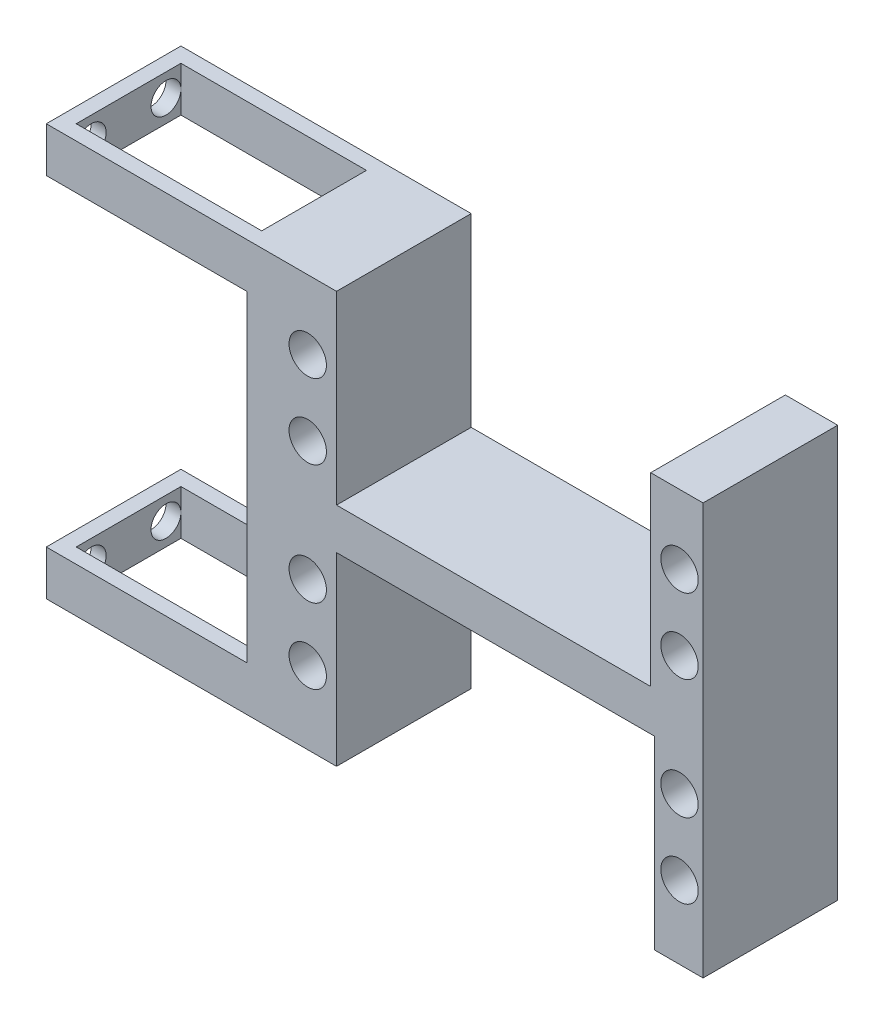
from build123d import *

# Parameters (mm, degrees)
SKETCH2_W           = 61
SKETCH2_H           = 55
SKETCH2_W_2         = 42
SKETCH2_H_2         = 20.5
SKETCH2_W_3         = 42.5
BOSS_EXTRUDE1_DEPTH = 18
SKETCH3_R           = 2.5
CUT_EXTRUDE1_DEPTH  = 10
SKETCH5_W           = 2
SKETCH5_H           = 6
BOSS_EXTRUDE2_DEPTH = 26.8
BOSS_EXTRUDE3_REACH = 85.678
SKETCH6_W           = 2
SKETCH6_H           = 6
SKETCH7_R           = 2
CUT_EXTRUDE2_DEPTH  = 10
CUT_EXTRUDE3_REACH  = 86.083
SKETCH8_W           = 42
SKETCH8_H           = 4.25
SKETCH8_W_2         = 42.5


with BuildPart() as part:
    # Sketch2 → Boss-Extrude1 (new body)
    with BuildSketch(Plane.XY):
        with Locations((30.5, 27.5)):
            Rectangle(SKETCH2_W, SKETCH2_H)
        with Locations((33, 40.5)):
            Rectangle(SKETCH2_W_2, SKETCH2_H_2, mode=Mode.SUBTRACT)
        with Locations((33.25, 14.5)):
            Rectangle(SKETCH2_W_3, SKETCH2_H_2, mode=Mode.SUBTRACT)
    extrude(amount=BOSS_EXTRUDE1_DEPTH)

    # Sketch3 → Cut-Extrude1 (cut)
    with BuildSketch(Plane.XY.offset(18)):
        with Locations((8.15, 45.75)):
            Circle(SKETCH3_R)
        with Locations((8.15, 35.75)):
            Circle(SKETCH3_R)
        with Locations((57.85, 35.75)):
            Circle(SKETCH3_R)
        with Locations((57.85, 45.75)):
            Circle(SKETCH3_R)
        with Locations((8.15, 19.75)):
            Circle(SKETCH3_R)
        with Locations((8.15, 9.75)):
            Circle(SKETCH3_R)
        with Locations((57.85, 9.75)):
            Circle(SKETCH3_R)
        with Locations((57.85, 19.75)):
            Circle(SKETCH3_R)
    extrude(amount=-CUT_EXTRUDE1_DEPTH, mode=Mode.SUBTRACT)

    # Sketch5 → Boss-Extrude2 (add)
    with BuildSketch(Plane.ZY):
        with Locations((1, 52)):
            Rectangle(SKETCH5_W, SKETCH5_H)
        with Locations((17, 52)):
            Rectangle(SKETCH5_W, SKETCH5_H)
        with Locations((1, 3)):
            Rectangle(SKETCH5_W, SKETCH5_H)
        with Locations((17, 3)):
            Rectangle(SKETCH5_W, SKETCH5_H)
    extrude(amount=BOSS_EXTRUDE2_DEPTH)

    # Sketch6 → Boss-Extrude3 (add, up to next)
    with BuildSketch(Plane.XY.offset(2), mode=Mode.PRIVATE) as boss_extrude3_sk1:
        with Locations((-25.8, 52)):
            Rectangle(SKETCH6_W, SKETCH6_H)
    boss_extrude3_tool1 = extrude(boss_extrude3_sk1.sketch, amount=BOSS_EXTRUDE3_REACH, mode=Mode.PRIVATE) - part.part
    # Sketch6 → Boss-Extrude3 (add, up to next)
    with BuildSketch(Plane.XY.offset(2), mode=Mode.PRIVATE) as boss_extrude3_sk2:
        with Locations((-25.8, 3)):
            Rectangle(SKETCH6_W, SKETCH6_H)
    boss_extrude3_tool2 = extrude(boss_extrude3_sk2.sketch, amount=BOSS_EXTRUDE3_REACH, mode=Mode.PRIVATE) - part.part
    add(boss_extrude3_tool1.solids().sort_by_distance((-25.8, 52, 2))[0])
    add(boss_extrude3_tool2.solids().sort_by_distance((-25.8, 3, 2))[0])

    # Sketch7 → Cut-Extrude2 (cut)
    with BuildSketch(Plane.ZY.offset(26.8)):
        with Locations((4, 52)):
            Circle(SKETCH7_R)
        with Locations((14, 52)):
            Circle(SKETCH7_R)
        with Locations((4, 3)):
            Circle(SKETCH7_R)
        with Locations((14, 3)):
            Circle(SKETCH7_R)
    extrude(amount=-CUT_EXTRUDE2_DEPTH, mode=Mode.SUBTRACT)

    # Sketch8 → Cut-Extrude3 (cut, up to next)
    with BuildSketch(Plane.XY.offset(18), mode=Mode.PRIVATE) as cut_extrude3_sk1:
        with Locations((33, 52.875)):
            Rectangle(SKETCH8_W, SKETCH8_H)
    cut_extrude3_tool1 = extrude(cut_extrude3_sk1.sketch, amount=-CUT_EXTRUDE3_REACH, mode=Mode.PRIVATE) & part.part
    # Sketch8 → Cut-Extrude3 (cut, up to next)
    with BuildSketch(Plane.XY.offset(18), mode=Mode.PRIVATE) as cut_extrude3_sk2:
        with Locations((33.25, 2.125)):
            Rectangle(SKETCH8_W_2, SKETCH8_H)
    cut_extrude3_tool2 = extrude(cut_extrude3_sk2.sketch, amount=-CUT_EXTRUDE3_REACH, mode=Mode.PRIVATE) & part.part
    add(cut_extrude3_tool1.solids().sort_by_distance((33, 52.875, 18))[0], mode=Mode.SUBTRACT)
    add(cut_extrude3_tool2.solids().sort_by_distance((33.25, 2.125, 18))[0], mode=Mode.SUBTRACT)


solid = part.part
